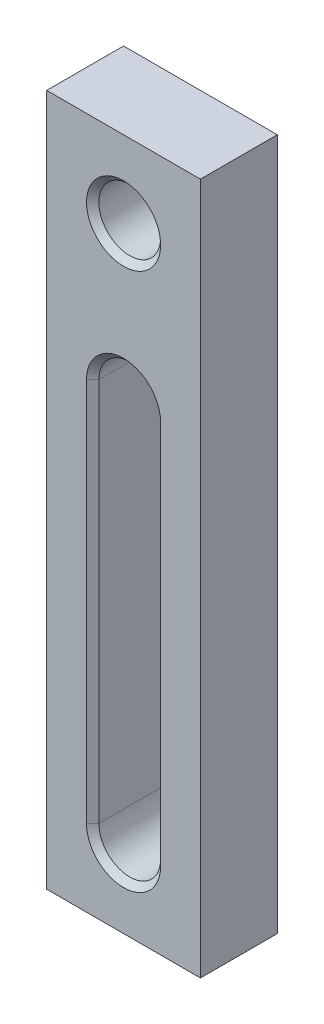
from build123d import *

# Parameters (mm, degrees)
SKETCH_1_W          = 50
SKETCH_1_H          = 225
EXTRUDE_1_DEPTH     = 25
SKETCH_2_R          = 10.05
CUT_EXTRUDE_1_DEPTH = 232.840462387
CHAMFER_1_SIZE      = 2


with BuildPart() as part:
    # Эскиз1 → Бобышка-Вытянуть1 (new body)
    with BuildSketch(Plane.XY):
        with Locations((25, 112.5)):
            Rectangle(SKETCH_1_W, SKETCH_1_H)
    extrude(amount=EXTRUDE_1_DEPTH)

    # Эскиз2 → Вырез-Вытянуть1 (cut, through all)
    with BuildSketch(Plane.XY.offset(25)):
        with Locations((25, 200)):
            Circle(SKETCH_2_R)
        with BuildLine():
            Line((14.95, 25), (14.95, 150))
            ThreePointArc((14.95, 150), (25, 160.05), (35.05, 150))
            Line((35.05, 150), (35.05, 25))
            ThreePointArc((35.05, 25), (25, 14.95), (14.95, 25))
        make_face()
    extrude(amount=-CUT_EXTRUDE_1_DEPTH, mode=Mode.SUBTRACT)

    # Фаска1
    chamfer_1_edges = [part.edges().sort_by_distance(p)[0] for p in [
        (14.95, 87.5, 0),
        (25, 14.95, 0),
        (25, 160.05, 0),
        (35.05, 87.5, 0),
        (35.05, 87.5, 25),
        (25, 160.05, 25),
        (25, 14.95, 25),
        (14.95, 87.5, 25),
        (14.95, 200, 0),
        (14.95, 200, 25),
    ]]
    chamfer(chamfer_1_edges, length=CHAMFER_1_SIZE)


solid = part.part
